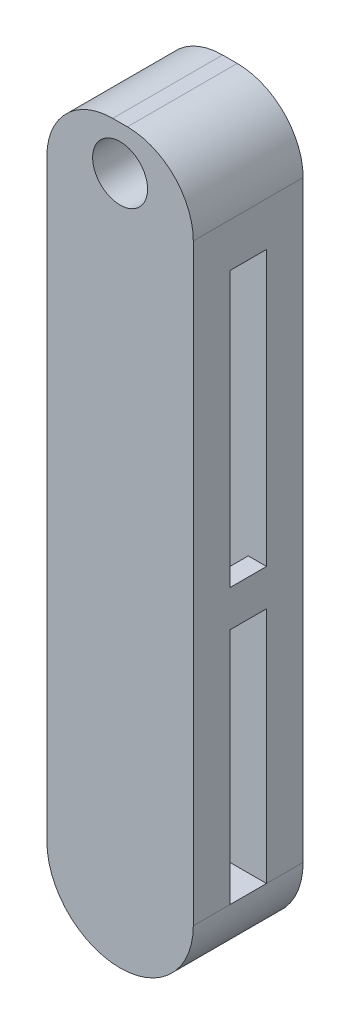
from build123d import *

# Parameters (mm, degrees)
SKETCH2_W           = 40
SKETCH2_H           = 200
BOSS_EXTRUDE1_DEPTH = 30
SKETCH3_R           = 2
CUT_EXTRUDE1_DEPTH  = 10
FILLET1_R           = 20
SKETCH5_R           = 7.5
CUT_EXTRUDE3_DEPTH  = 20
FILLET2_R           = 18
SKETCH6_W           = 10
SKETCH6_H           = 150
CUT_EXTRUDE4_DEPTH  = 112.803398875
SKETCH7_W           = 5
SKETCH7_H           = 10
BOSS_EXTRUDE2_DEPTH = 15


with BuildPart() as part:
    # Sketch2 → Boss-Extrude1 (new body)
    with BuildSketch(Plane.XY):
        Rectangle(SKETCH2_W, SKETCH2_H)
    extrude(amount=BOSS_EXTRUDE1_DEPTH)

    # Sketch3 → Cut-Extrude1 (cut)
    with BuildSketch(Plane(origin=(0, 0, 0), x_dir=(-1, 0, 0), z_dir=(0, 0, -1))):
        with Locations((0, -90)):
            Circle(SKETCH3_R)
    extrude(amount=-CUT_EXTRUDE1_DEPTH, mode=Mode.SUBTRACT)

    # Fillet1
    fillet1_edges = [part.edges().sort_by_distance(p)[0] for p in [
        (20, -100, 15),
        (-20, -100, 15),
    ]]
    fillet(fillet1_edges, radius=FILLET1_R - 0.0001)  # a hair under: the kernel refuses the full size

    # Sketch5 → Cut-Extrude3 (cut)
    with BuildSketch(Plane.XY.offset(30)):
        with Locations((0, 88)):
            Circle(SKETCH5_R)
    extrude(amount=-CUT_EXTRUDE3_DEPTH, mode=Mode.SUBTRACT)

    # Fillet2
    fillet2_edges = [part.edges().sort_by_distance(p)[0] for p in [
        (-20, 100, 15),
        (20, 100, 15),
    ]]
    fillet(fillet2_edges, radius=FILLET2_R)

    # Sketch6 → Cut-Extrude4 (cut, through all)
    with BuildSketch(Plane.ZY.offset(20)):
        with Locations((15, -5)):
            Rectangle(SKETCH6_W, SKETCH6_H)
    extrude(amount=-CUT_EXTRUDE4_DEPTH, mode=Mode.SUBTRACT)

    # Sketch7 → Boss-Extrude2 (add)
    with BuildSketch(Plane(origin=(0, 0, 20), x_dir=(-1, 0, 0), z_dir=(0, 0, -1))):
        with Locations((17.5, -10)):
            Rectangle(SKETCH7_W, SKETCH7_H)
    boss_extrude2 = extrude(amount=BOSS_EXTRUDE2_DEPTH)

    # Mirror1: Boss-Extrude2 across plane
    add(boss_extrude2.mirror(Plane(origin=(0, 0, 0), x_dir=(0, 0, 1), z_dir=(1, 0, 0))))


solid = part.part
